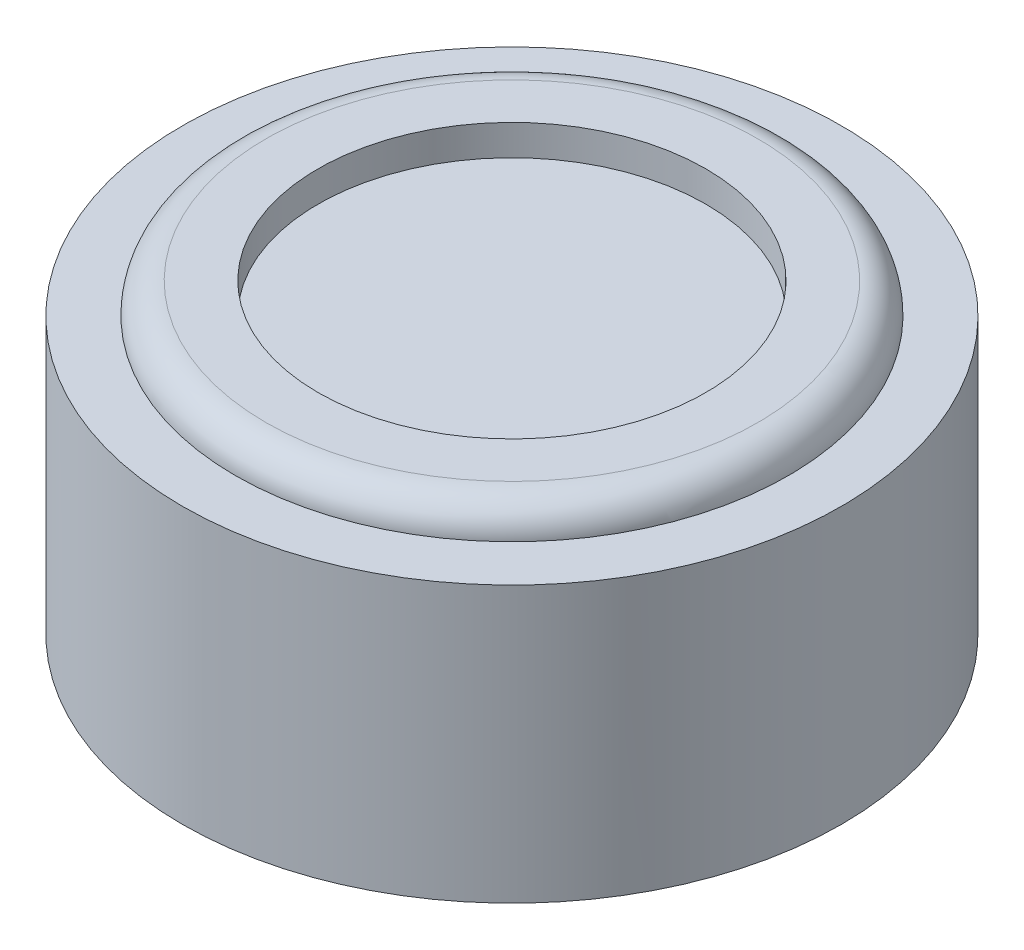
from build123d import *

# Parameters (mm, degrees)
SKETCH1_R           = 16.15
BOSS_EXTRUDE1_DEPTH = 16.5
SKETCH2_OUTSIDE_W   = 44.014
SKETCH2_OUTSIDE_H   = 44.014
SKETCH2_OUTSIDE_R   = 13.55
CUT_EXTRUDE1_DEPTH  = 1.5
SKETCH3_R           = 9.5
CUT_EXTRUDE2_DEPTH  = 1.5
SKETCH4_OUTSIDE_W   = 44.014
SKETCH4_OUTSIDE_H   = 44.014
SKETCH4_OUTSIDE_R   = 13.55
CUT_EXTRUDE3_DEPTH  = 1.5
SKETCH5_R           = 12
CUT_EXTRUDE4_DEPTH  = 1.5
SKETCH6_R           = 1.4
CUT_EXTRUDE7_DEPTH  = 2.5
FILLET2_R           = 1.5


with BuildPart() as part:
    # Sketch1 → Boss-Extrude1 (new body)
    with BuildSketch(Plane(origin=(0, 0, 0), x_dir=(1, 0, 0), z_dir=(0, 1, 0))):
        with Locations(Location((0, 0, 0), (0, 0, 270))):
            Circle(SKETCH1_R)
    extrude(amount=-BOSS_EXTRUDE1_DEPTH)

    # Sketch2 outside → Cut-Extrude1 (cut)
    with BuildSketch(Plane(origin=(0, 0, 0), x_dir=(1, 0, 0), z_dir=(0, 1, 0))):
        Rectangle(SKETCH2_OUTSIDE_W, SKETCH2_OUTSIDE_H)
        with Locations(Location((0, 0, 0), (0, 0, 270))):
            Circle(SKETCH2_OUTSIDE_R, mode=Mode.SUBTRACT)
    extrude(amount=-CUT_EXTRUDE1_DEPTH, mode=Mode.SUBTRACT)

    # Sketch3 → Cut-Extrude2 (cut)
    with BuildSketch(Plane(origin=(0, 0, 0), x_dir=(1, 0, 0), z_dir=(0, 1, 0))):
        with Locations(Location((0, 0, 0), (0, 0, 270))):
            Circle(SKETCH3_R)
    extrude(amount=-CUT_EXTRUDE2_DEPTH, mode=Mode.SUBTRACT)

    # Sketch4 outside → Cut-Extrude3 (cut)
    with BuildSketch(Plane(origin=(0, -16.5, 0), x_dir=(-1, 0, 0), z_dir=(0, -1, 0))):
        Rectangle(SKETCH4_OUTSIDE_W, SKETCH4_OUTSIDE_H)
        with Locations(Location((0, 0, 0), (0, 0, 270))):
            Circle(SKETCH4_OUTSIDE_R, mode=Mode.SUBTRACT)
    extrude(amount=-CUT_EXTRUDE3_DEPTH, mode=Mode.SUBTRACT)

    # Sketch5 → Cut-Extrude4 (cut)
    with BuildSketch(Plane(origin=(0, -16.5, 0), x_dir=(-1, 0, 0), z_dir=(0, -1, 0))):
        with Locations(Location((0, 0, 0), (0, 0, 90))):
            Circle(SKETCH5_R)
    extrude(amount=-CUT_EXTRUDE4_DEPTH, mode=Mode.SUBTRACT)

    # Sketch6 → Cut-Extrude7 (cut)
    with BuildSketch(Plane(origin=(0, -16.5, 0), x_dir=(-1, 0, 0), z_dir=(0, -1, 0))):
        with Locations(Location((0, 8.5, 0), (0, 0, 90))):
            Circle(SKETCH6_R)
        with Locations(Location((6.01040764, 6.01040764, 0), (0, 0, 90))):
            Circle(SKETCH6_R)
        with Locations(Location((-6.01040764, 6.01040764, 0), (0, 0, 90))):
            Circle(SKETCH6_R)
        with Locations(Location((0, -8.5, 0), (0, 0, 90))):
            Circle(SKETCH6_R)
    extrude(amount=-CUT_EXTRUDE7_DEPTH, mode=Mode.SUBTRACT)

    # Fillet2
    fillet2_edges = [part.edges().sort_by_distance(p)[0] for p in [
        (0, 0, -13.55),
    ]]
    fillet(fillet2_edges, radius=FILLET2_R - 0.0001)  # a hair under: the kernel refuses the full size


solid = part.part
